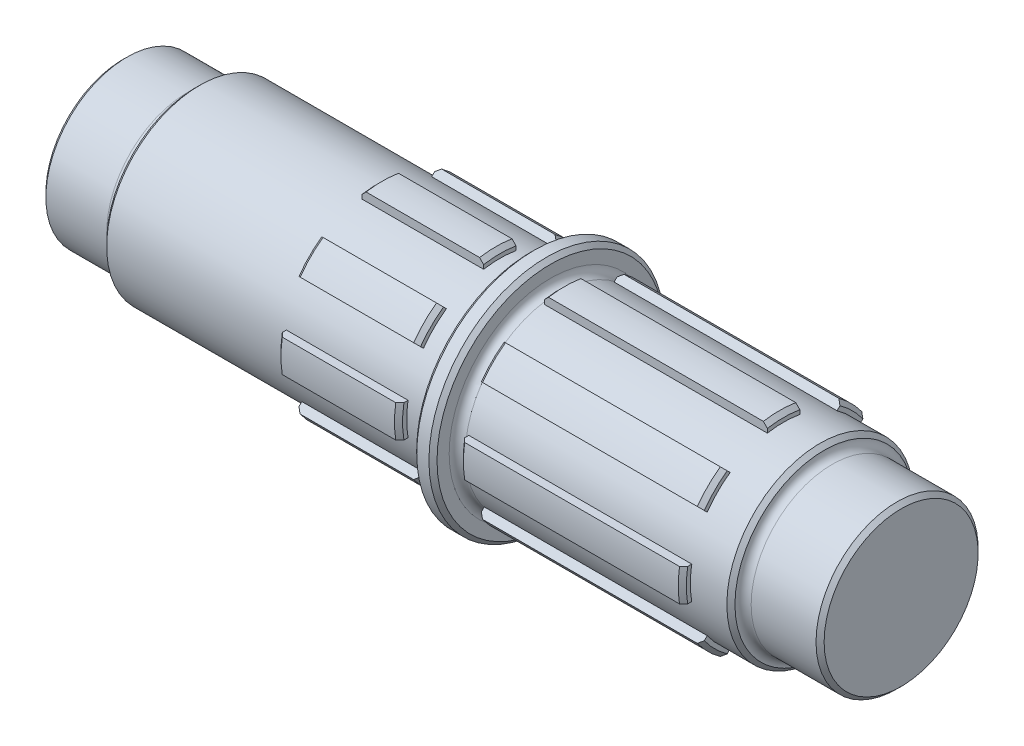
from build123d import *
from build123d.topology import SkipClean

# Parameters (mm, degrees)
CHAMFER1_SIZE      = 1
CUT_EXTRUDE1_REACH = 137.362
CHAMFER2_SIZE      = 1
CUT_EXTRUDE2_DEPTH = 55
FILLET1_R          = 2


with BuildPart() as part:
    # Sketch1 → Revolve1 (revolve)
    with BuildSketch(Plane.XY, mode=Mode.PRIVATE) as revolve1_sk:
        Polygon((-119.281437126, 0), (-119.281437126, 20), (-101.281437126, 20), (-101.281437126, 23), (-56.281437126, 23), (-56.281437126, 25), (-26.281437126, 25), (-26.281437126, 23), (-18.781437126, 23), (-18.781437126, 29), (-13.781437126, 29), (-13.781437126, 23), (-11.281437126, 23), (-11.281437126, 25), (43.718562874, 25), (43.718562874, 23), (53.718562874, 23), (53.718562874, 20), (72.718562874, 20), (72.718562874, 0), align=None)
    revolve(revolve1_sk.sketch.rotate(Axis((-133.413173653, 0, 0), (1, 0, 0)), 90), axis=Axis((-133.413173653, 0, 0), (1, 0, 0)))

    # Chamfer1
    chamfer1_edges = [part.edges().sort_by_distance(p)[0] for p in [
        (72.718562874, 0, -20),
        (53.718562874, 0, -23),
        (43.718562874, 0, -25),
        (-13.781437126, 0, -29),
        (-18.781437126, 0, -29),
        (-26.281437126, 0, -25),
        (-56.281437126, 0, -25),
        (-101.281437126, 0, -23),
        (-119.281437126, 0, -20),
    ]]
    chamfer(chamfer1_edges, length=CHAMFER1_SIZE)

    # Cut-Extrude1: up to this face of the body (flat: up to its plane)
    cut_extrude1_end = Plane(part.part.faces().sort_by_distance((-26.281437126, 0, -23.32117749))[0])
    # Sketch2 → Cut-Extrude1 (cut, up to the picked face)
    with BuildSketch(Plane.ZY.offset(56.281437126), mode=Mode.PRIVATE) as cut_extrude1_sk1:
        with BuildLine():
            Line((-4, 24.677925359), (-4, 22.649503306))
            ThreePointArc((-4, 22.649503306), (-8.801718944, 21.249229248), (-13.187190253, 18.844044503))
            Line((-13.187190253, 18.844044503), (-14.621501242, 20.278355491))
            ThreePointArc((-14.621501242, 20.278355491), (-9.567085809, 23.096988313), (-4, 24.677925359))
        make_face()
    cut_extrude1_tool1 = split(extrude(cut_extrude1_sk1.sketch, amount=-CUT_EXTRUDE1_REACH, mode=Mode.PRIVATE), bisect_by=cut_extrude1_end, keep=Keep.BOTH, mode=Mode.PRIVATE)
    # Sketch2 → Cut-Extrude1 (cut, up to the picked face)
    with BuildSketch(Plane.ZY.offset(56.281437126), mode=Mode.PRIVATE) as cut_extrude1_sk2:
        with BuildLine():
            Line((4, 24.677925359), (4, 22.649503306))
            ThreePointArc((4, 22.649503306), (8.801718944, 21.249229248), (13.187190253, 18.844044503))
            Line((13.187190253, 18.844044503), (14.621501242, 20.278355491))
            ThreePointArc((14.621501242, 20.278355491), (9.567085809, 23.096988313), (4, 24.677925359))
        make_face()
    cut_extrude1_tool2 = split(extrude(cut_extrude1_sk2.sketch, amount=-CUT_EXTRUDE1_REACH, mode=Mode.PRIVATE), bisect_by=cut_extrude1_end, keep=Keep.BOTH, mode=Mode.PRIVATE)
    # Sketch2 → Cut-Extrude1 (cut, up to the picked face)
    with BuildSketch(Plane.ZY.offset(56.281437126), mode=Mode.PRIVATE) as cut_extrude1_sk3:
        with BuildLine():
            Line((20.278355491, 14.621501242), (18.844044503, 13.187190253))
            ThreePointArc((18.844044503, 13.187190253), (21.249229248, 8.801718944), (22.649503306, 4))
            Line((22.649503306, 4), (24.677925359, 4))
            ThreePointArc((24.677925359, 4), (23.096988313, 9.567085809), (20.278355491, 14.621501242))
        make_face()
    cut_extrude1_tool3 = split(extrude(cut_extrude1_sk3.sketch, amount=-CUT_EXTRUDE1_REACH, mode=Mode.PRIVATE), bisect_by=cut_extrude1_end, keep=Keep.BOTH, mode=Mode.PRIVATE)
    # Sketch2 → Cut-Extrude1 (cut, up to the picked face)
    with BuildSketch(Plane.ZY.offset(56.281437126), mode=Mode.PRIVATE) as cut_extrude1_sk4:
        with BuildLine():
            Line((24.677925359, -4), (22.649503306, -4))
            ThreePointArc((22.649503306, -4), (21.249229248, -8.801718944), (18.844044503, -13.187190253))
            Line((18.844044503, -13.187190253), (20.278355491, -14.621501242))
            ThreePointArc((20.278355491, -14.621501242), (23.096988313, -9.567085809), (24.677925359, -4))
        make_face()
    cut_extrude1_tool4 = split(extrude(cut_extrude1_sk4.sketch, amount=-CUT_EXTRUDE1_REACH, mode=Mode.PRIVATE), bisect_by=cut_extrude1_end, keep=Keep.BOTH, mode=Mode.PRIVATE)
    # Sketch2 → Cut-Extrude1 (cut, up to the picked face)
    with BuildSketch(Plane.ZY.offset(56.281437126), mode=Mode.PRIVATE) as cut_extrude1_sk5:
        with BuildLine():
            Line((14.621501242, -20.278355491), (13.187190253, -18.844044503))
            ThreePointArc((13.187190253, -18.844044503), (8.801718944, -21.249229248), (4, -22.649503306))
            Line((4, -22.649503306), (4, -24.677925359))
            ThreePointArc((4, -24.677925359), (9.567085809, -23.096988313), (14.621501242, -20.278355491))
        make_face()
    cut_extrude1_tool5 = split(extrude(cut_extrude1_sk5.sketch, amount=-CUT_EXTRUDE1_REACH, mode=Mode.PRIVATE), bisect_by=cut_extrude1_end, keep=Keep.BOTH, mode=Mode.PRIVATE)
    # Sketch2 → Cut-Extrude1 (cut, up to the picked face)
    with BuildSketch(Plane.ZY.offset(56.281437126), mode=Mode.PRIVATE) as cut_extrude1_sk6:
        with BuildLine():
            Line((-4, -24.677925359), (-4, -22.649503306))
            ThreePointArc((-4, -22.649503306), (-8.801718944, -21.249229248), (-13.187190253, -18.844044503))
            Line((-13.187190253, -18.844044503), (-14.621501242, -20.278355491))
            ThreePointArc((-14.621501242, -20.278355491), (-9.567085809, -23.096988313), (-4, -24.677925359))
        make_face()
    cut_extrude1_tool6 = split(extrude(cut_extrude1_sk6.sketch, amount=-CUT_EXTRUDE1_REACH, mode=Mode.PRIVATE), bisect_by=cut_extrude1_end, keep=Keep.BOTH, mode=Mode.PRIVATE)
    # Sketch2 → Cut-Extrude1 (cut, up to the picked face)
    with BuildSketch(Plane.ZY.offset(56.281437126), mode=Mode.PRIVATE) as cut_extrude1_sk7:
        with BuildLine():
            Line((-20.278355491, -14.621501242), (-18.844044503, -13.187190253))
            ThreePointArc((-18.844044503, -13.187190253), (-21.249229248, -8.801718944), (-22.649503306, -4))
            Line((-22.649503306, -4), (-24.677925359, -4))
            ThreePointArc((-24.677925359, -4), (-23.096988313, -9.567085809), (-20.278355491, -14.621501242))
        make_face()
    cut_extrude1_tool7 = split(extrude(cut_extrude1_sk7.sketch, amount=-CUT_EXTRUDE1_REACH, mode=Mode.PRIVATE), bisect_by=cut_extrude1_end, keep=Keep.BOTH, mode=Mode.PRIVATE)
    # Sketch2 → Cut-Extrude1 (cut, up to the picked face)
    with BuildSketch(Plane.ZY.offset(56.281437126), mode=Mode.PRIVATE) as cut_extrude1_sk8:
        with BuildLine():
            Line((-24.677925359, 4), (-22.649503306, 4))
            ThreePointArc((-22.649503306, 4), (-21.249229248, 8.801718944), (-18.844044503, 13.187190253))
            Line((-18.844044503, 13.187190253), (-20.278355491, 14.621501242))
            ThreePointArc((-20.278355491, 14.621501242), (-23.096988313, 9.567085809), (-24.677925359, 4))
        make_face()
    cut_extrude1_tool8 = split(extrude(cut_extrude1_sk8.sketch, amount=-CUT_EXTRUDE1_REACH, mode=Mode.PRIVATE), bisect_by=cut_extrude1_end, keep=Keep.BOTH, mode=Mode.PRIVATE)
    add(cut_extrude1_tool1.solids().sort_by(Axis((-56.281437, 22.008011, -9.116017), (1, 0, 0)))[0], mode=Mode.SUBTRACT)
    add(cut_extrude1_tool2.solids().sort_by(Axis((-56.281437, 22.008011, 9.116017), (1, 0, 0)))[0], mode=Mode.SUBTRACT)
    add(cut_extrude1_tool3.solids().sort_by(Axis((-56.281437, 9.116017, 22.008011), (1, 0, 0)))[0], mode=Mode.SUBTRACT)
    add(cut_extrude1_tool4.solids().sort_by(Axis((-56.281437, -9.116017, 22.008011), (1, 0, 0)))[0], mode=Mode.SUBTRACT)
    add(cut_extrude1_tool5.solids().sort_by(Axis((-56.281437, -22.008011, 9.116017), (1, 0, 0)))[0], mode=Mode.SUBTRACT)
    add(cut_extrude1_tool6.solids().sort_by(Axis((-56.281437, -22.008011, -9.116017), (1, 0, 0)))[0], mode=Mode.SUBTRACT)
    add(cut_extrude1_tool7.solids().sort_by(Axis((-56.281437, -9.116017, -22.008011), (1, 0, 0)))[0], mode=Mode.SUBTRACT)
    add(cut_extrude1_tool8.solids().sort_by(Axis((-56.281437, 9.116017, -22.008011), (1, 0, 0)))[0], mode=Mode.SUBTRACT)

    # Chamfer2
    chamfer2_edges = [part.edges().sort_by_distance(p)[0] for p in [
        (-11.281437126, 0, -25),
    ]]
    chamfer(chamfer2_edges, length=CHAMFER2_SIZE)

    # Sketch3 → Cut-Extrude2 (cut)
    with SkipClean():  # the faces are left unmerged after this step: merging them gives an invalid solid
        with BuildSketch(Plane(origin=(43.718562874, 0, 0), x_dir=(0, 0, -1), z_dir=(1, 0, 0))):
            with BuildLine():
                Line((-4, 22.649503306), (-4, 24.677925359))
                ThreePointArc((-4, 24.677925359), (-9.567085809, 23.096988313), (-14.621501242, 20.278355491))
                Line((-14.621501242, 20.278355491), (-13.187190253, 18.844044503))
                ThreePointArc((-13.187190253, 18.844044503), (-8.801718944, 21.249229248), (-4, 22.649503306))
            make_face()
            with BuildLine():
                Line((4, -22.649503306), (4, -24.677925359))
                ThreePointArc((4, -24.677925359), (9.567085809, -23.096988313), (14.621501242, -20.278355491))
                Line((14.621501242, -20.278355491), (13.187190253, -18.844044503))
                ThreePointArc((13.187190253, -18.844044503), (8.801718944, -21.249229248), (4, -22.649503306))
            make_face()
            with BuildLine():
                Line((-13.187190253, -18.844044503), (-14.621501242, -20.278355491))
                ThreePointArc((-14.621501242, -20.278355491), (-9.567085809, -23.096988313), (-4, -24.677925359))
                Line((-4, -24.677925359), (-4, -22.649503306))
                ThreePointArc((-4, -22.649503306), (-8.801718944, -21.249229248), (-13.187190253, -18.844044503))
            make_face()
            with BuildLine():
                Line((-22.649503306, -4), (-24.677925359, -4))
                ThreePointArc((-24.677925359, -4), (-23.096988313, -9.567085809), (-20.278355491, -14.621501242))
                Line((-20.278355491, -14.621501242), (-18.844044503, -13.187190253))
                ThreePointArc((-18.844044503, -13.187190253), (-21.249229248, -8.801718944), (-22.649503306, -4))
            make_face()
            with BuildLine():
                Line((-18.844044503, 13.187190253), (-20.278355491, 14.621501242))
                ThreePointArc((-20.278355491, 14.621501242), (-23.096988313, 9.567085809), (-24.677925359, 4))
                Line((-24.677925359, 4), (-22.649503306, 4))
                ThreePointArc((-22.649503306, 4), (-21.249229248, 8.801718944), (-18.844044503, 13.187190253))
            make_face()
            with BuildLine():
                Line((13.187190253, 18.844044503), (14.621501242, 20.278355491))
                ThreePointArc((14.621501242, 20.278355491), (9.567085809, 23.096988313), (4, 24.677925359))
                Line((4, 24.677925359), (4, 22.649503306))
                ThreePointArc((4, 22.649503306), (8.801718944, 21.249229248), (13.187190253, 18.844044503))
            make_face()
            with BuildLine():
                Line((22.649503306, 4), (24.677925359, 4))
                ThreePointArc((24.677925359, 4), (23.096988313, 9.567085809), (20.278355491, 14.621501242))
                Line((20.278355491, 14.621501242), (18.844044503, 13.187190253))
                ThreePointArc((18.844044503, 13.187190253), (21.249229248, 8.801718944), (22.649503306, 4))
            make_face()
            with BuildLine():
                Line((18.844044503, -13.187190253), (20.278355491, -14.621501242))
                ThreePointArc((20.278355491, -14.621501242), (23.096988313, -9.567085809), (24.677925359, -4))
                Line((24.677925359, -4), (22.649503306, -4))
                ThreePointArc((22.649503306, -4), (21.249229248, -8.801718944), (18.844044503, -13.187190253))
            make_face()
        extrude(amount=-CUT_EXTRUDE2_DEPTH, mode=Mode.SUBTRACT)

    # Fillet1
    fillet1_edges = [part.edges().sort_by_distance(p)[0] for p in [
        (53.718562874, 0, -20),
        (-13.781437126, 0, -23),
        (-18.781437126, 0, -23),
        (-101.281437126, 0, -20),
    ]]
    fillet(fillet1_edges, radius=FILLET1_R - 0.0001)  # a hair under: the kernel refuses the full size


solid = part.part
